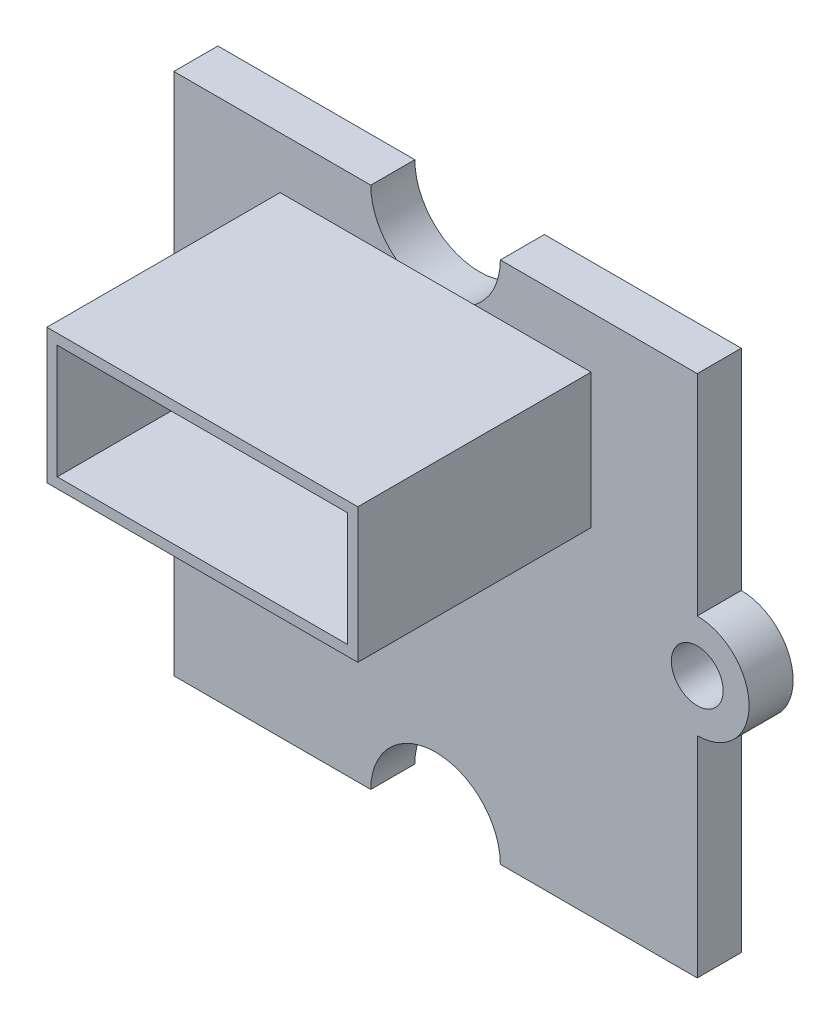
from build123d import *

# Parameters (mm, degrees)
CROQUIS1_R              = 1
SALIENTE_EXTRUIR1_DEPTH = 1.7
CROQUIS2_W              = 12
CROQUIS2_H              = 5.2
CROQUIS2_W_2            = 11.2
CROQUIS2_H_2            = 4.4
SALIENTE_EXTRUIR2_DEPTH = 9


with BuildPart() as part:
    # Croquis1 → Saliente-Extruir1 (new body)
    with BuildSketch(Plane.XY):
        with BuildLine():
            Line((-2.5, 10.1), (-10.1, 10.1))
            Line((-10.1, 10.1), (-10.1, 2))
            ThreePointArc((-10.1, 2), (-12.1, 0), (-10.1, -2))
            Line((-10.1, -2), (-10.1, -10.1))
            Line((-10.1, -10.1), (-2.5, -10.1))
            ThreePointArc((-2.5, -10.1), (0, -7.6), (2.5, -10.1))
            Line((2.5, -10.1), (10.1, -10.1))
            Line((10.1, -10.1), (10.1, -2))
            ThreePointArc((10.1, -2), (12.1, 0), (10.1, 2))
            Line((10.1, 2), (10.1, 10.1))
            Line((10.1, 10.1), (2.5, 10.1))
            ThreePointArc((2.5, 10.1), (0, 7.6), (-2.5, 10.1))
        make_face()
        with Locations((-10.1, 0)):
            Circle(CROQUIS1_R, mode=Mode.SUBTRACT)
        with Locations((10.1, 0)):
            Circle(CROQUIS1_R, mode=Mode.SUBTRACT)
    extrude(amount=SALIENTE_EXTRUIR1_DEPTH)

    # Croquis2 → Saliente-Extruir2 (add)
    with BuildSketch(Plane.XY.offset(1.7)):
        with Locations((0, 5.5)):
            Rectangle(CROQUIS2_W, CROQUIS2_H)
        with Locations((0, 5.5)):
            Rectangle(CROQUIS2_W_2, CROQUIS2_H_2, mode=Mode.SUBTRACT)
    extrude(amount=SALIENTE_EXTRUIR2_DEPTH)


solid = part.part
